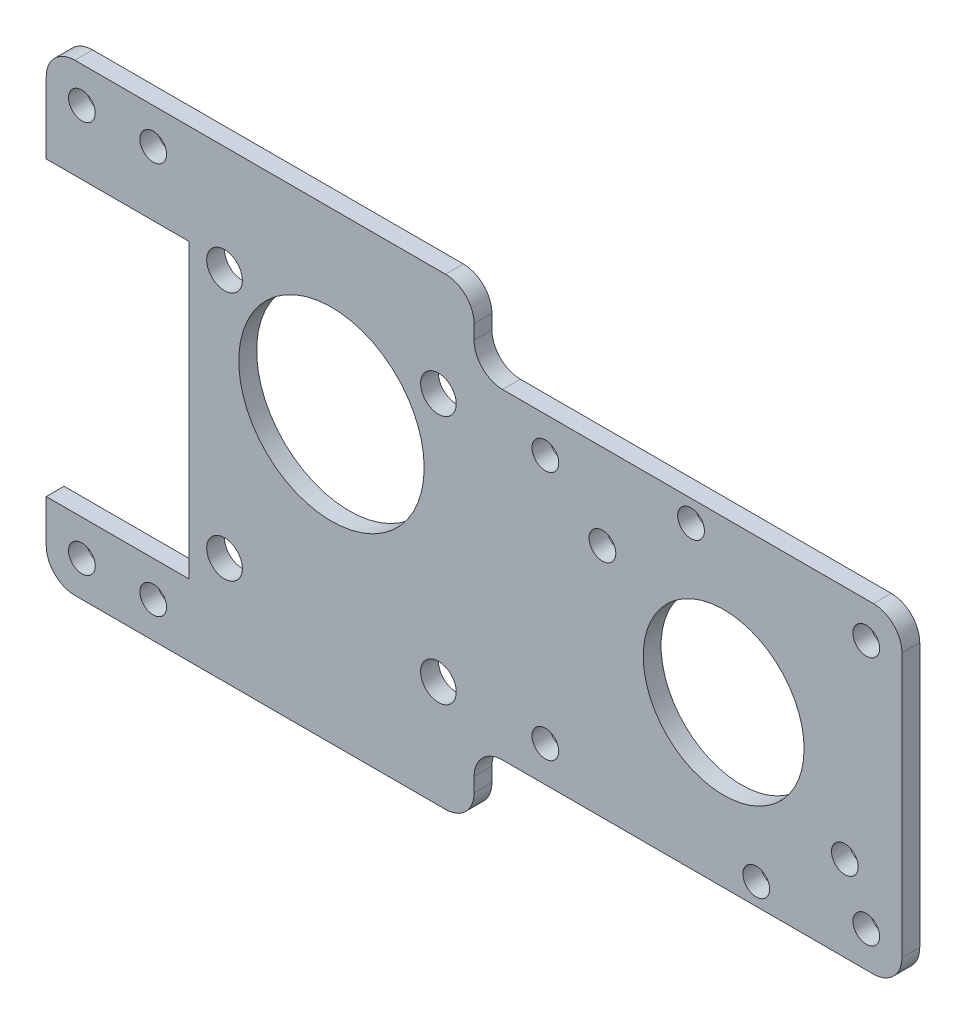
from build123d import *

# Parameters (mm, degrees)
SKETCH1_W           = 127
SKETCH1_H           = 57.15
SKETCH1_R           = 2.38125
SKETCH1_R_2         = 14.3256
BOSS_EXTRUDE1_DEPTH = 3.175
SKETCH2_R           = 2.38125
CUT_EXTRUDE1_DEPTH  = 3.175
FILLET1_R           = 5.08
SKETCH3_R           = 3.175
CUT_EXTRUDE2_DEPTH  = 3.175
SKETCH4_R           = 16.51
CUT_EXTRUDE3_DEPTH  = 7.62
SKETCH5_W           = 76.2
SKETCH5_H           = 12.7
BOSS_EXTRUDE2_DEPTH = 3.175
FILLET2_R           = 5.08
SKETCH6_W           = 25.4
SKETCH6_H           = 5.08
BOSS_EXTRUDE3_DEPTH = 3.175
FILLET3_R           = 5.08
SKETCH7_R           = 2.38125
CUT_EXTRUDE4_DEPTH  = 3.175


with BuildPart() as part:
    # Sketch1 → Boss-Extrude1 (new body)
    with BuildSketch(Plane.XY):
        Rectangle(SKETCH1_W, SKETCH1_H)
        with Locations((37.555148495, -24.727722316)):
            Circle(SKETCH1_R, mode=Mode.SUBTRACT)
        with Locations((53.34, -13.380280266)):
            Circle(SKETCH1_R, mode=Mode.SUBTRACT)
        with Locations((10.16, 13.380280266)):
            Circle(SKETCH1_R, mode=Mode.SUBTRACT)
        with Locations((31.75, 0)):
            Circle(SKETCH1_R_2, mode=Mode.SUBTRACT)
        with Locations((25.944851505, 24.727722316)):
            Circle(SKETCH1_R, mode=Mode.SUBTRACT)
    extrude(amount=BOSS_EXTRUDE1_DEPTH)

    # Sketch2 → Cut-Extrude1 (cut)
    with BuildSketch(Plane.XY.offset(3.175)):
        with Locations((57.15, 22.225)):
            Circle(SKETCH2_R)
        with Locations((57.15, -22.225)):
            Circle(SKETCH2_R)
        with Locations((0, 22.225)):
            Circle(SKETCH2_R)
        with Locations((0, -22.225)):
            Circle(SKETCH2_R)
    extrude(amount=-CUT_EXTRUDE1_DEPTH, mode=Mode.SUBTRACT)

    # Fillet1
    fillet1_edges = [part.edges().sort_by_distance(p)[0] for p in [
        (63.5, -28.575, 1.5875),
        (63.5, 28.575, 1.5875),
    ]]
    fillet(fillet1_edges, radius=FILLET1_R)

    # Sketch3 → Cut-Extrude2 (cut)
    with BuildSketch(Plane.XY.offset(3.175)):
        with Locations((-57.15, 22.225)):
            Circle(SKETCH3_R)
        with Locations((-19.05, 22.225)):
            Circle(SKETCH3_R)
        with Locations((-19.05, -22.225)):
            Circle(SKETCH3_R)
        with Locations((-57.15, -22.225)):
            Circle(SKETCH3_R)
    extrude(amount=-CUT_EXTRUDE2_DEPTH, mode=Mode.SUBTRACT)

    # Sketch4 → Cut-Extrude3 (cut)
    with BuildSketch(Plane.XY.offset(3.175)):
        with Locations((-38.1, 9.525)):
            Circle(SKETCH4_R)
    extrude(amount=-CUT_EXTRUDE3_DEPTH, mode=Mode.SUBTRACT)

    # Sketch5 → Boss-Extrude2 (add)
    with BuildSketch(Plane.XY.offset(3.175)):
        with Locations((-50.8, -34.925)):
            Rectangle(SKETCH5_W, SKETCH5_H)
        with Locations((-50.8, 34.925)):
            Rectangle(SKETCH5_W, SKETCH5_H)
    extrude(amount=-BOSS_EXTRUDE2_DEPTH)

    # Fillet2
    fillet2_edges = [part.edges().sort_by_distance(p)[0] for p in [
        (-12.7, -41.275, 1.5875),
        (-12.7, -28.575, 1.5875),
        (-12.7, 41.275, 1.5875),
        (-12.7, 28.575, 1.5875),
    ]]
    fillet(fillet2_edges, radius=FILLET2_R)

    # Sketch6 → Boss-Extrude3 (add)
    with BuildSketch(Plane.XY.offset(3.175)):
        with Locations((-76.2, 26.035)):
            Rectangle(SKETCH6_W, SKETCH6_H)
    extrude(amount=-BOSS_EXTRUDE3_DEPTH)

    # Fillet3
    fillet3_edges = [part.edges().sort_by_distance(p)[0] for p in [
        (-88.9, 41.275, 1.5875),
        (-88.9, -41.275, 1.5875),
    ]]
    fillet(fillet3_edges, radius=FILLET3_R)

    # Sketch7 → Cut-Extrude4 (cut)
    with BuildSketch(Plane.XY.offset(3.175)):
        with Locations((-82.55, 34.925)):
            Circle(SKETCH7_R)
        with Locations((-82.55, -34.925)):
            Circle(SKETCH7_R)
        with Locations((-69.85, 34.925)):
            Circle(SKETCH7_R)
        with Locations((-69.85, -34.925)):
            Circle(SKETCH7_R)
    extrude(amount=-CUT_EXTRUDE4_DEPTH, mode=Mode.SUBTRACT)


solid = part.part
